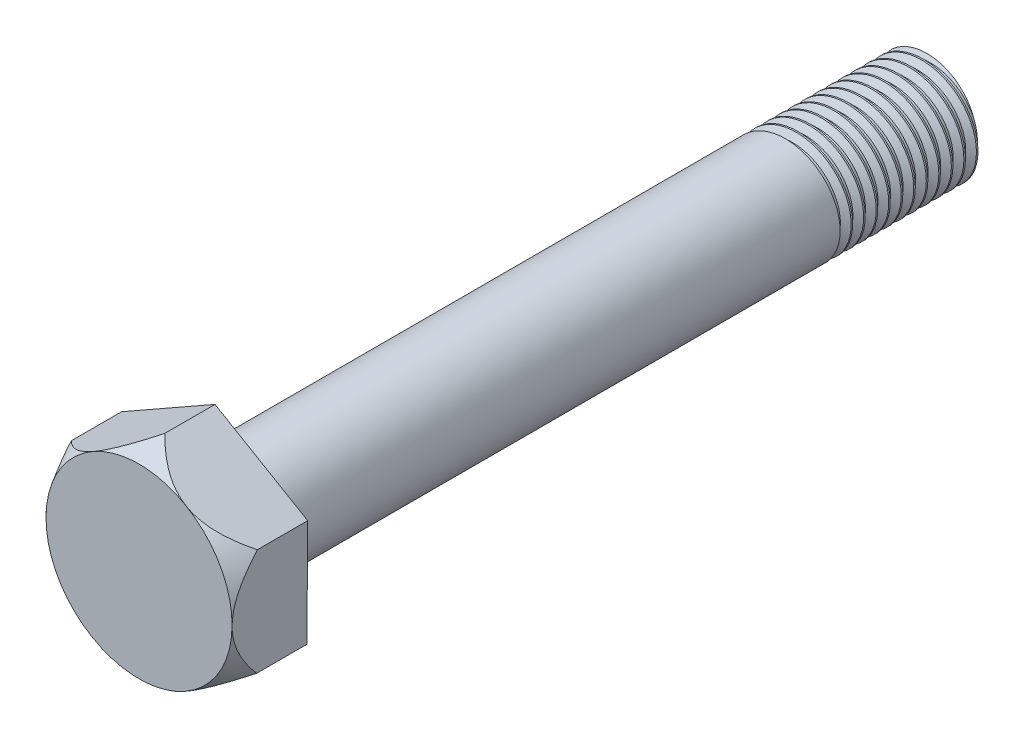
from build123d import *

# Parameters (mm, degrees)
BOSS_EXTRUDE1_DEPTH = 21
SKETCH2_OUTSIDE_W   = 94.87
SKETCH2_OUTSIDE_H   = 102.696
SKETCH2_OUTSIDE_R   = 25.981415203
CUT_EXTRUDE1_DEPTH  = 21
CUT_EXTRUDE1_DRAFT  = -30
SKETCH3_R           = 15
BOSS_EXTRUDE3_DEPTH = 200
THREAD1_PITCH       = 3.5


with BuildPart() as part:
    # Sketch1 → Boss-Extrude1 (new body)
    with BuildSketch(Plane.XY):
        Polygon((26.087119961, 14.815782804), (0.212715695, 30), (-25.874404266, 15.184217196), (-26.087119961, -14.815782804), (-0.212715695, -30), (25.874404266, -15.184217196), align=None)
    extrude(amount=BOSS_EXTRUDE1_DEPTH)


with BuildPart() as cut_extrude1_tool:
    # Sketch2 outside → Cut-Extrude1 (with draft: the straight prism first)
    with BuildSketch(Plane.XY.offset(21)):
        Rectangle(SKETCH2_OUTSIDE_W, SKETCH2_OUTSIDE_H)
        Circle(SKETCH2_OUTSIDE_R, mode=Mode.SUBTRACT)
    extrude(amount=-CUT_EXTRUDE1_DEPTH)
    # Cut-Extrude1: the draft: its side faces are tilted about the plane it starts from
    cut_extrude1_sides = [cut_extrude1_tool.faces().sort_by_distance(p)[0] for p in [
        (0, -51.348, 10.5),
        (47.435, 0, 10.5),
        (0, 51.348, 10.5),
        (-47.435, 0, 10.5),
        (-25.981415203, 0, 10.5),
    ]]
    draft(cut_extrude1_sides, Plane.XY.offset(21), CUT_EXTRUDE1_DRAFT)


with BuildPart() as part_1:
    add(part.part)

    # Cut-Extrude1: cut by cut_extrude1_tool
    add(cut_extrude1_tool.part, mode=Mode.SUBTRACT)

    # Sketch3 → Boss-Extrude3 (add)
    with BuildSketch(Plane(origin=(0, 0, 0), x_dir=(-1, 0, 0), z_dir=(0, 0, -1))):
        Circle(SKETCH3_R)
    extrude(amount=BOSS_EXTRUDE3_DEPTH)

    # Thread1: the profile of Thread Profile3 profile screwed along a right-hand helix of 12 turns, 12 arcs to a turn; built about Z, then put on its axis
    thread1_z = Axis((0, 0, 0), (0, 0, 1))
    thread1_corners = [(15.0003, 0, -0.000173205), (15.0003, 0, 3.062673196), (13.105569437, 0, 1.968749995), (13.105569437, 0, 1.093749995)]
    with BuildLine(mode=Mode.PRIVATE) as thread1_profile:
        Line(thread1_corners[0], thread1_corners[1])
        Line(thread1_corners[1], thread1_corners[2])
        Line(thread1_corners[2], thread1_corners[3])
        Line(thread1_corners[3], thread1_corners[0])
    thread1_cap = Face(thread1_profile.wire())
    thread1_turn_angles = [0, 15, 30, 45, 60, 75, 90, 105, 120, 135, 150, 165, 180, 195, 210, 225, 240, 255, 270, 285, 300, 315, 330, 345, 360]
    thread1_turn_weights = [1, 0.9659258262890683, 1, 0.9659258262890683, 1, 0.9659258262890683, 1, 0.9659258262890683, 1, 0.9659258262890683, 1, 0.9659258262890683, 1, 0.9659258262890683, 1, 0.9659258262890683, 1, 0.9659258262890683, 1, 0.9659258262890683, 1, 0.9659258262890683, 1, 0.9659258262890683, 1]
    thread1_turn_rails = [Edge.make_bspline([Vector(p[0], p[1], 0).rotate(thread1_z, thread1_turn_angles[k]) / thread1_turn_weights[k] + Vector(0, 0, p[2] + THREAD1_PITCH * thread1_turn_angles[k] / 360) for k in range(25)], [0, 0, 0, 1, 1, 2, 2, 3, 3, 4, 4, 5, 5, 6, 6, 7, 7, 8, 8, 9, 9, 10, 10, 11, 11, 12, 12, 12], 2, thread1_turn_weights) for p in thread1_corners]
    thread1_turn_sides = [Face.make_surface_from_curves(thread1_turn_rails[p[0]], thread1_turn_rails[p[1]]) for p in [(0, 1), (1, 2), (2, 3), (3, 0)]]
    thread1 = Plane(origin=(0, 0, -158), x_dir=(-1, 0, 0), z_dir=(0, 0, -1)) * Solid(Shell([*[p.moved(Location((0, 0, THREAD1_PITCH * i))) for i in range(12) for p in thread1_turn_sides], thread1_cap, thread1_cap.rotate(thread1_z, 4320).moved(Location((0, 0, THREAD1_PITCH * 4320 / 360)))]))
    add(thread1, mode=Mode.SUBTRACT)


solid = part_1.part
